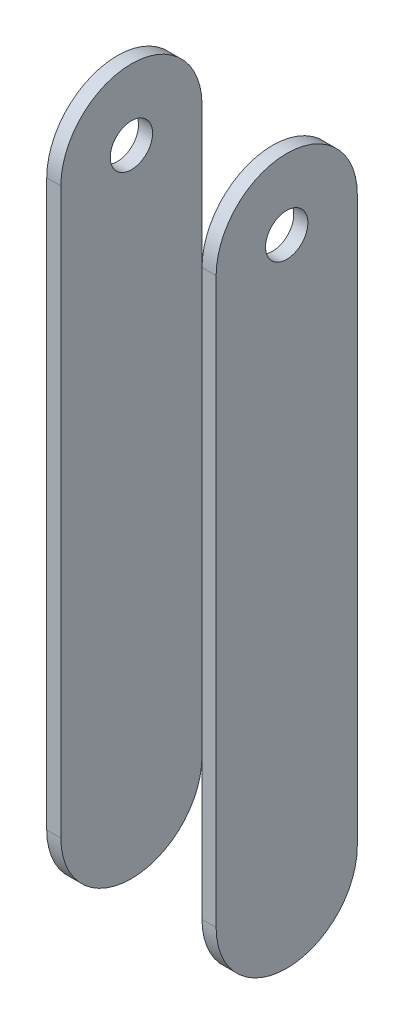
from build123d import *

# Parameters (mm, degrees)
BOSS_EXTRUDE1_START = 19.05
SKETCH1_R           = 4.7625
BOSS_EXTRUDE1_DEPTH = 3.175


with BuildPart() as part:
    # Sketch1 → Boss-Extrude1 (new body)
    with BuildSketch(Plane(origin=(0, 0, 0), x_dir=(0, 0, -1), z_dir=(1, 0, 0)).offset(BOSS_EXTRUDE1_START)):
        with BuildLine():
            Line((-15.875, 0), (-15.875, 127))
            ThreePointArc((-15.875, 127), (0, 142.875), (15.875, 127))
            Line((15.875, 127), (15.875, 0))
            ThreePointArc((15.875, 0), (0, -15.875), (-15.875, 0))
        make_face()
        with Locations((0, 127)):
            Circle(SKETCH1_R, mode=Mode.SUBTRACT)
    extrude(amount=-BOSS_EXTRUDE1_DEPTH)


with BuildPart() as body_2:
    # Mirror3: mirrored copy
    add(part.part.mirror(Plane(origin=(0, 0, 0), x_dir=(0, 0, 1), z_dir=(1, 0, 0))))


solid = Compound([part.part, body_2.part])
